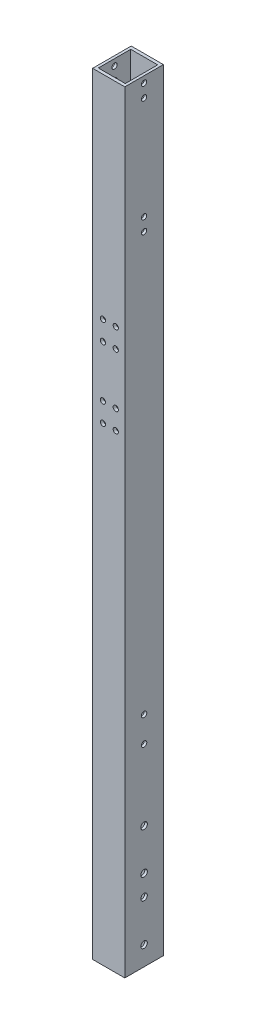
from build123d import *

# Parameters (mm, degrees)
SKETCH_1_W           = 25
SKETCH_1_H           = 30
SKETCH_1_W_2         = 21
SKETCH_1_H_2         = 25.2
EXTRUDE_1_DEPTH      = 600
SKETCH_3_R           = 2.05
SKETCH_3_R_2         = 2.55
CUT_EXTRUDE_2_DEPTH  = 601.707915713
SKETCH_4_R           = 2.05
CUT_EXTRUDE_3_DEPTH  = 601.87956364
SKETCH_6_R           = 2.55
CUT_EXTRUDE_4_DEPTH  = 42
CUT_EXTRUDE_5_REACH  = 602.708
SKETCH_7_R           = 2.1
SKETCH_8_OUTSIDE_W   = 152.254
SKETCH_8_OUTSIDE_H   = 722.254
SKETCH_8_OUTSIDE_W_2 = 30
SKETCH_8_OUTSIDE_H_2 = 600
CUT_EXTRUDE_8_DEPTH  = 5


with BuildPart() as part:
    # 草图1 → 凸台-拉伸1 (new body)
    with BuildSketch(Plane(origin=(0, 0, 0), x_dir=(1, 0, 0), z_dir=(0, 1, 0))):
        Rectangle(SKETCH_1_W, SKETCH_1_H)
        Rectangle(SKETCH_1_W_2, SKETCH_1_H_2, mode=Mode.SUBTRACT)
    extrude(amount=EXTRUDE_1_DEPTH)

    # 草图3 → 切除-拉伸2 (cut, through all)
    with BuildSketch(Plane.ZY.offset(12.5)):
        with Locations((0, 595)):
            Circle(SKETCH_3_R)
        with Locations((0, 585)):
            Circle(SKETCH_3_R)
        with Locations((0, 505)):
            Circle(SKETCH_3_R)
        with Locations((0, 495)):
            Circle(SKETCH_3_R)
        with Locations((0, 15)):
            Circle(SKETCH_3_R_2)
        with Locations((0, 47)):
            Circle(SKETCH_3_R_2)
    extrude(amount=-CUT_EXTRUDE_2_DEPTH, mode=Mode.SUBTRACT)

    # 草图4 → 切除-拉伸3 (cut, through all)
    with BuildSketch(Plane.XY.offset(15)):
        with Locations((5.5, 435)):
            Circle(SKETCH_4_R)
        with Locations((-4.5, 435)):
            Circle(SKETCH_4_R)
        with Locations((-4.5, 420)):
            Circle(SKETCH_4_R)
        with Locations((5.5, 420)):
            Circle(SKETCH_4_R)
        with Locations((-4.5, 380)):
            Circle(SKETCH_4_R)
        with Locations((-4.5, 365)):
            Circle(SKETCH_4_R)
        with Locations((5.5, 365)):
            Circle(SKETCH_4_R)
        with Locations((5.5, 380)):
            Circle(SKETCH_4_R)
    extrude(amount=-CUT_EXTRUDE_3_DEPTH, mode=Mode.SUBTRACT)

    # 草图6 → 切除-拉伸4 (cut)
    with BuildSketch(Plane.ZY.offset(12.5)):
        with Locations((0, 63)):
            Circle(SKETCH_6_R)
        with Locations((0, 95)):
            Circle(SKETCH_6_R)
    extrude(amount=-CUT_EXTRUDE_4_DEPTH, mode=Mode.SUBTRACT)

    # 草图7 → 切除-拉伸5 (cut, up to next)
    with BuildSketch(Plane(origin=(12.5, 0, 0), x_dir=(0, 0, -1), z_dir=(1, 0, 0)), mode=Mode.PRIVATE) as cut_extrude_5_sk1:
        with Locations((0, 150)):
            Circle(SKETCH_7_R)
    cut_extrude_5_tool1 = extrude(cut_extrude_5_sk1.sketch, amount=-CUT_EXTRUDE_5_REACH, mode=Mode.PRIVATE) & part.part
    # 草图7 → 切除-拉伸5 (cut, up to next)
    with BuildSketch(Plane(origin=(12.5, 0, 0), x_dir=(0, 0, -1), z_dir=(1, 0, 0)), mode=Mode.PRIVATE) as cut_extrude_5_sk2:
        with Locations((0, 170)):
            Circle(SKETCH_7_R)
    cut_extrude_5_tool2 = extrude(cut_extrude_5_sk2.sketch, amount=-CUT_EXTRUDE_5_REACH, mode=Mode.PRIVATE) & part.part
    add(cut_extrude_5_tool1.solids().sort_by_distance((12.5, 150, 0))[0], mode=Mode.SUBTRACT)
    add(cut_extrude_5_tool2.solids().sort_by_distance((12.5, 170, 0))[0], mode=Mode.SUBTRACT)

    # 草图8 outside → 切除-拉伸8 (cut)
    # profile 1 of 2: a face of its own
    with BuildSketch(Plane.ZY.offset(12.5)):
        with Locations((0, 300)):
            Rectangle(SKETCH_8_OUTSIDE_W, SKETCH_8_OUTSIDE_H)
        with Locations((0, 300)):
            Rectangle(SKETCH_8_OUTSIDE_W_2, SKETCH_8_OUTSIDE_H_2, mode=Mode.SUBTRACT)
    # profile 2 of 2: a face of its own
    with BuildSketch(Plane.ZY.offset(12.5)):
        with BuildLine():
            Line((5, 175), (5, 145))
            ThreePointArc((5, 145), (0, 140), (-5, 145))
            Line((-5, 145), (-5, 175))
            ThreePointArc((-5, 175), (0, 180), (5, 175))
        make_face()
    extrude(amount=-CUT_EXTRUDE_8_DEPTH, mode=Mode.SUBTRACT)


solid = part.part
